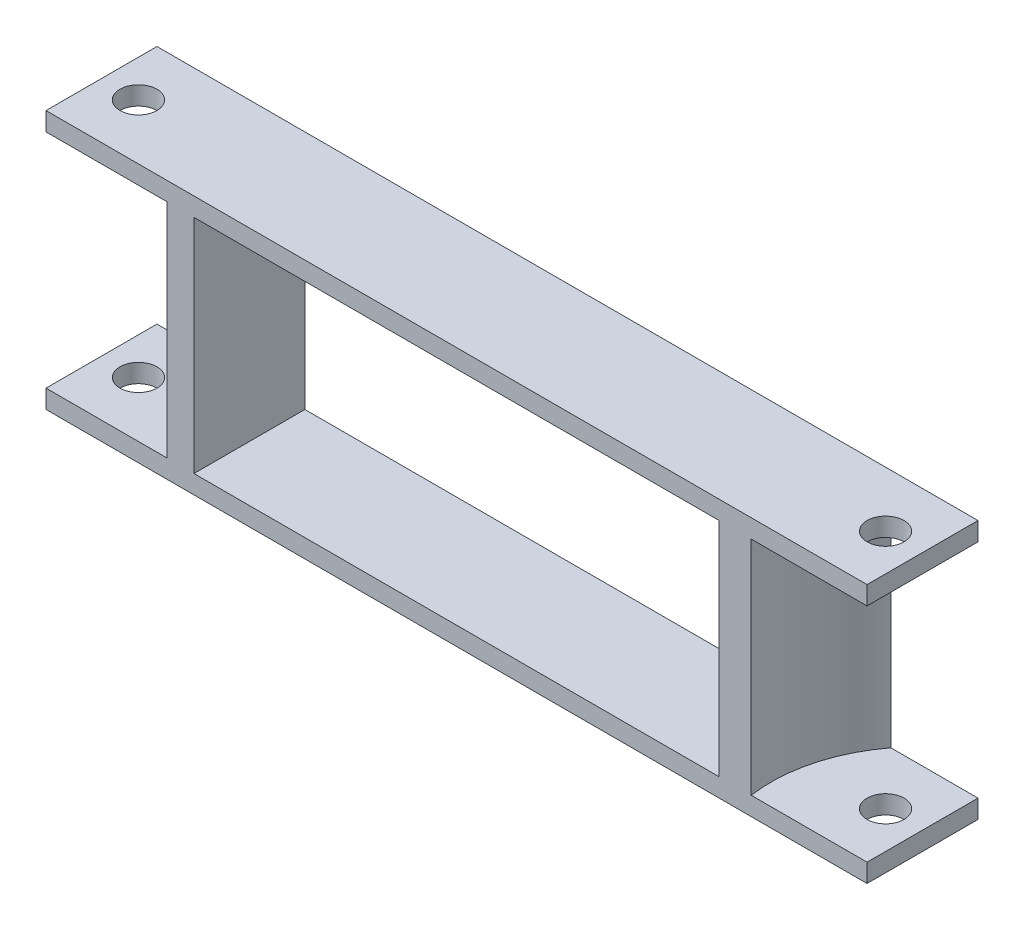
from build123d import *

# Parameters (mm, degrees)
CROQUIS1_W                 = 222
CROQUIS1_H                 = 30
CROQUIS1_R                 = 5
SALIENTE_EXTRUIR1_DEPTH    = 70
CORTAR_EXTRUIR1_DEPTH      = 30
CORTAR_EXTRUIR1_DEPTH_BACK = 30
CROQUIS2_R                 = 40
CROQUIS3_W                 = 142
CROQUIS3_H                 = 60
CORTAR_EXTRUIR2_DEPTH      = 201.889443058


with BuildPart() as part:
    # Croquis1 → Saliente-Extruir1 (new body)
    with BuildSketch(Plane(origin=(0, 0, 0), x_dir=(1, 0, 0), z_dir=(0, 1, 0))):
        with Locations((74.893970672, 3.671875)):
            Rectangle(CROQUIS1_W, CROQUIS1_H)
        with Locations((-26.106029328, 3.671875)):
            Circle(CROQUIS1_R, mode=Mode.SUBTRACT)
        with Locations((175.893970672, 3.671875)):
            Circle(CROQUIS1_R, mode=Mode.SUBTRACT)
    extrude(amount=SALIENTE_EXTRUIR1_DEPTH)

    # Croquis2 → Cortar-Extruir1 (cut, two sides: drawn at the far end of the back side and taken through both)
    with BuildSketch(Plane(origin=(0, 35, 0), x_dir=(-1, 0, 0), z_dir=(0, -1, 0)).offset(-CORTAR_EXTRUIR1_DEPTH_BACK)):
        with Locations((42.379372645, -2.333916419)):
            Circle(CROQUIS2_R)
        with Locations((-194.158036126, -5.581508709)):
            Circle(CROQUIS2_R)
    extrude(amount=CORTAR_EXTRUIR1_DEPTH + CORTAR_EXTRUIR1_DEPTH_BACK, mode=Mode.SUBTRACT)

    # Croquis3 → Cortar-Extruir2 (cut, through all)
    with BuildSketch(Plane.XY.offset(11.328125)):
        with Locations((74.893970672, 35)):
            Rectangle(CROQUIS3_W, CROQUIS3_H)
    extrude(amount=-CORTAR_EXTRUIR2_DEPTH, mode=Mode.SUBTRACT)


solid = part.part
